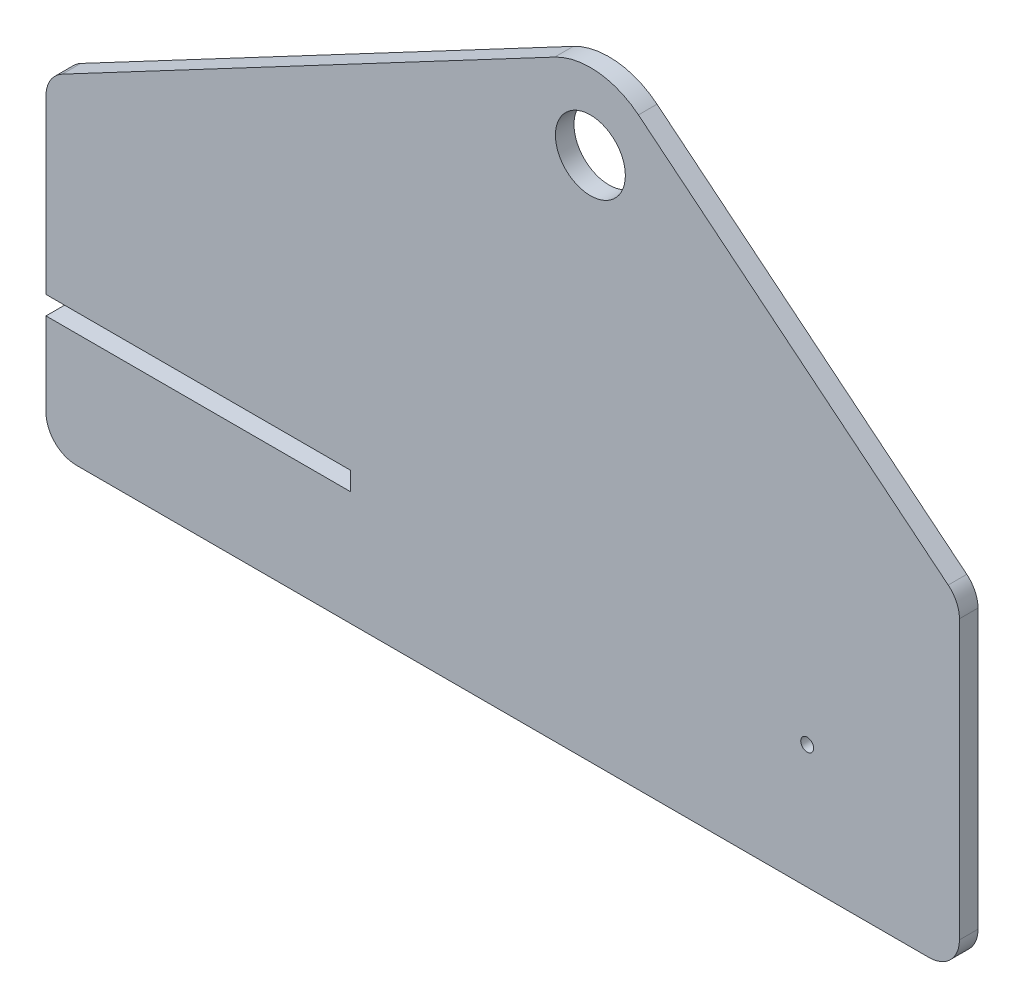
from build123d import *

# Parameters (mm, degrees)
BOSS_EXTRUDE1_DEPTH = 3.0988
SKETCH3_R           = 1.0795
SKETCH3_R_2         = 5.835705454
BOSS_EXTRUDE2_DEPTH = 3.0988
FILLET1_R           = 5.08


with BuildPart() as part:
    # Sketch2 → Boss-Extrude1 (new body)
    with BuildSketch(Plane.XY):
        Polygon((-50.8, 1.5494), (-50.8, 7.8994), (50.8, 7.8994), (50.8, -7.8994), (-50.8, -7.8994), (-50.8, -1.5494), (0, -1.5494), (0, 1.5494), align=None)
    extrude(amount=BOSS_EXTRUDE1_DEPTH)

    # Sketch3 → Boss-Extrude2 (add)
    with BuildSketch(Plane.XY):
        with BuildLine():
            Line((50.8, -7.8994), (-50.8, -7.8994))
            Line((-50.8, -7.8994), (-50.8, -20.5994))
            Line((-50.8, -20.5994), (101.6, -20.5994))
            Line((101.6, -20.5994), (101.6, 33.2994))
            Line((101.6, 33.2994), (48.046970753, 76.914189356))
            ThreePointArc((48.046970753, 76.914189356), (41.270233754, 79.705819767), (34.079455343, 78.288050201))
            Line((34.079455343, 78.288050201), (-50.8, 33.2994))
            Line((-50.8, 33.2994), (-50.8, 7.8994))
            Line((-50.8, 7.8994), (50.8, 7.8994))
            Line((50.8, 7.8994), (50.8, -7.8994))
        make_face()
        with Locations((76.2, 0)):
            Circle(SKETCH3_R, mode=Mode.SUBTRACT)
        with Locations((40.027046569, 67.066813254)):
            Circle(SKETCH3_R_2, mode=Mode.SUBTRACT)
    extrude(amount=BOSS_EXTRUDE2_DEPTH)

    # Fillet1
    fillet1_edges = [part.edges().sort_by_distance(p)[0] for p in [
        (101.6, 33.2994, 1.5494),
        (101.6, -20.5994, 1.5494),
        (-50.8, -20.5994, 1.5494),
        (-50.8, 33.2994, 1.5494),
    ]]
    fillet(fillet1_edges, radius=FILLET1_R)


solid = part.part
